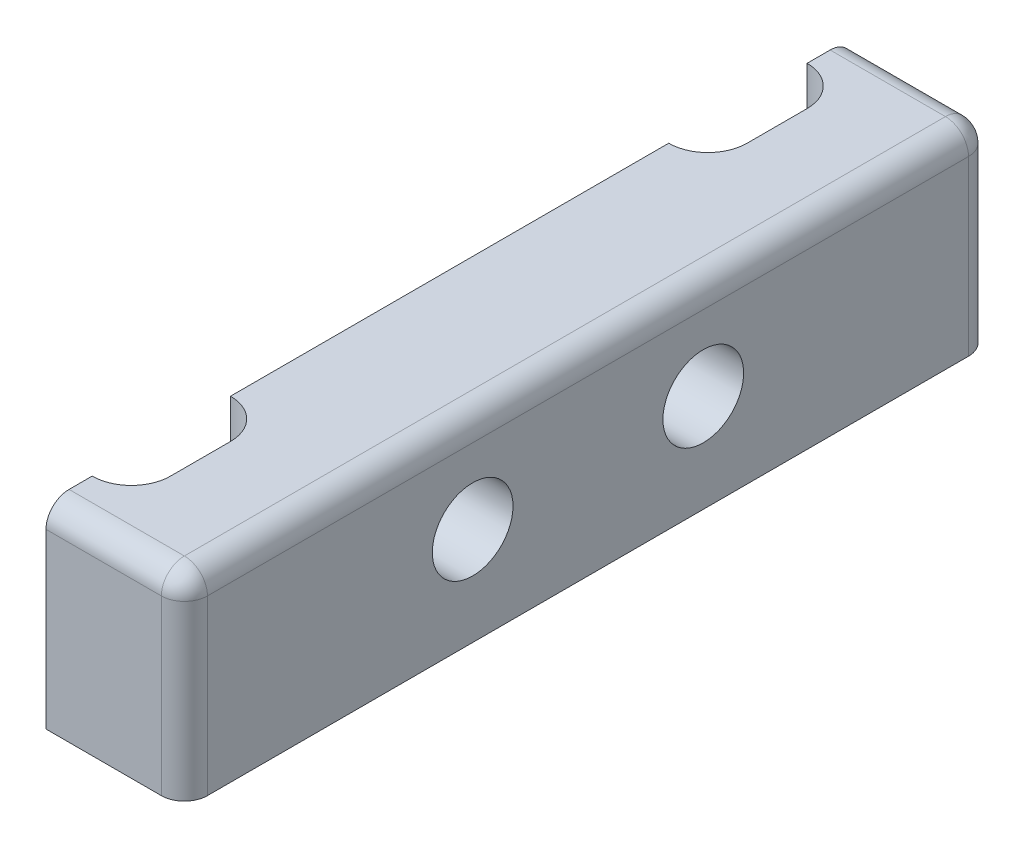
from build123d import *

# Parameters (mm, degrees)
BASE_DEPTH           = 8.5
SKETCH2_R            = 1.75
SCREW_HOLES_DEPTH    = 21.359273072
F_1MM_EDGE_FILLETS_R = 1


with BuildPart() as part:
    # Sketch1 → Base (new body)
    with BuildSketch(Plane(origin=(0, 0, 0), x_dir=(1, 0, 0), z_dir=(0, 1, 0))):
        with BuildLine():
            Line((-6, 17.5), (-6, 15.5))
            ThreePointArc((-6, 15.5), (-4.797918472, 15.002081528), (-4.3, 13.8))
            Line((-4.3, 13.8), (-4.3, 11.2))
            ThreePointArc((-4.3, 11.2), (-4.797918472, 9.997918472), (-6, 9.5))
            Line((-6, 9.5), (-6, -9.5))
            ThreePointArc((-6, -9.5), (-4.797918472, -9.997918472), (-4.3, -11.2))
            Line((-4.3, -11.2), (-4.3, -13.8))
            ThreePointArc((-4.3, -13.8), (-4.797918472, -15.002081528), (-6, -15.5))
            Line((-6, -15.5), (-6, -17.5))
            Line((-6, -17.5), (0, -17.5))
            Line((0, -17.5), (0, 17.5))
            Line((0, 17.5), (-6, 17.5))
        make_face()
    extrude(amount=BASE_DEPTH)

    # Sketch2 → Screw Holes (cut, through all)
    with BuildSketch(Plane.ZY.offset(6)):
        with Locations((-5, 4.25)):
            Circle(SKETCH2_R)
        with Locations((5, 4.25)):
            Circle(SKETCH2_R)
    extrude(amount=-SCREW_HOLES_DEPTH, mode=Mode.SUBTRACT)

    # 1mm Edge Fillets
    f_1mm_edge_fillets_edges = [part.edges().sort_by_distance(p)[0] for p in [
        (0, 4.25, -17.5),
        (-3, 8.5, -17.5),
        (0, 8.5, 0),
        (0, 4.25, 17.5),
        (-3, 8.5, 17.5),
    ]]
    fillet(f_1mm_edge_fillets_edges, radius=F_1MM_EDGE_FILLETS_R)


solid = part.part
